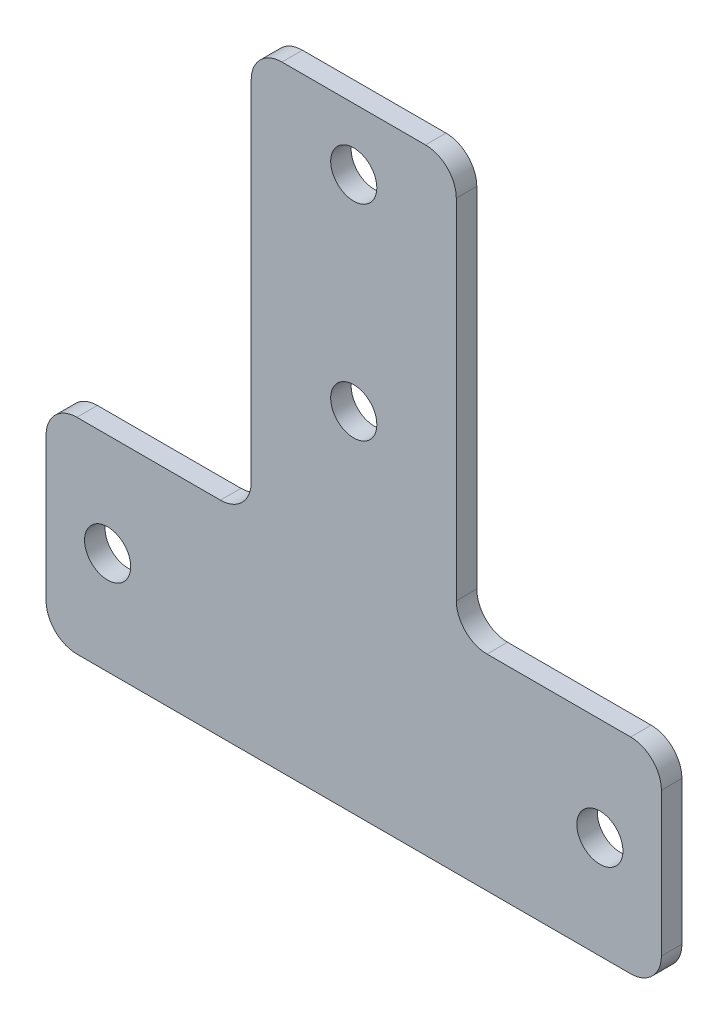
from build123d import *

# Parameters (mm, degrees)
SKETCH_1_R             = 2.25
SM_BASE_FLANGE_1_DEPTH = 2


# Sheet-metal steps are written as plain solids
with BuildPart() as part:
    # Sketch 1 → 基体-法兰1 (new body)
    with BuildSketch(Plane.XY):
        with BuildLine():
            Line((-27, 0), (27, 0))
            ThreePointArc((27, 0), (29.121320344, 0.878679656), (30, 3))
            Line((30, 3), (30, 17))
            ThreePointArc((30, 17), (29.121320344, 19.121320344), (27, 20))
            Line((27, 20), (13, 20))
            ThreePointArc((13, 20), (10.878679656, 20.878679656), (10, 23))
            Line((10, 23), (10, 32.5))
            Line((10, 32.5), (10, 57))
            ThreePointArc((10, 57), (9.121320344, 59.121320344), (7, 60))
            Line((7, 60), (-7, 60))
            ThreePointArc((-7, 60), (-9.121320344, 59.121320344), (-10, 57))
            Line((-10, 57), (-10, 23))
            ThreePointArc((-10, 23), (-10.878679656, 20.878679656), (-13, 20))
            Line((-13, 20), (-27, 20))
            ThreePointArc((-27, 20), (-29.121320344, 19.121320344), (-30, 17))
            Line((-30, 17), (-30, 3))
            ThreePointArc((-30, 3), (-29.121320344, 0.878679656), (-27, 0))
        make_face()
        with Locations((-24, 10)):
            Circle(SKETCH_1_R, mode=Mode.SUBTRACT)
        with Locations(Location((24, 10, 0), (0, 0, 180))):
            Circle(SKETCH_1_R, mode=Mode.SUBTRACT)
        with Locations((0, 54)):
            Circle(SKETCH_1_R, mode=Mode.SUBTRACT)
        with Locations((0, 34)):
            Circle(SKETCH_1_R, mode=Mode.SUBTRACT)
    extrude(amount=-SM_BASE_FLANGE_1_DEPTH)


solid = part.part
